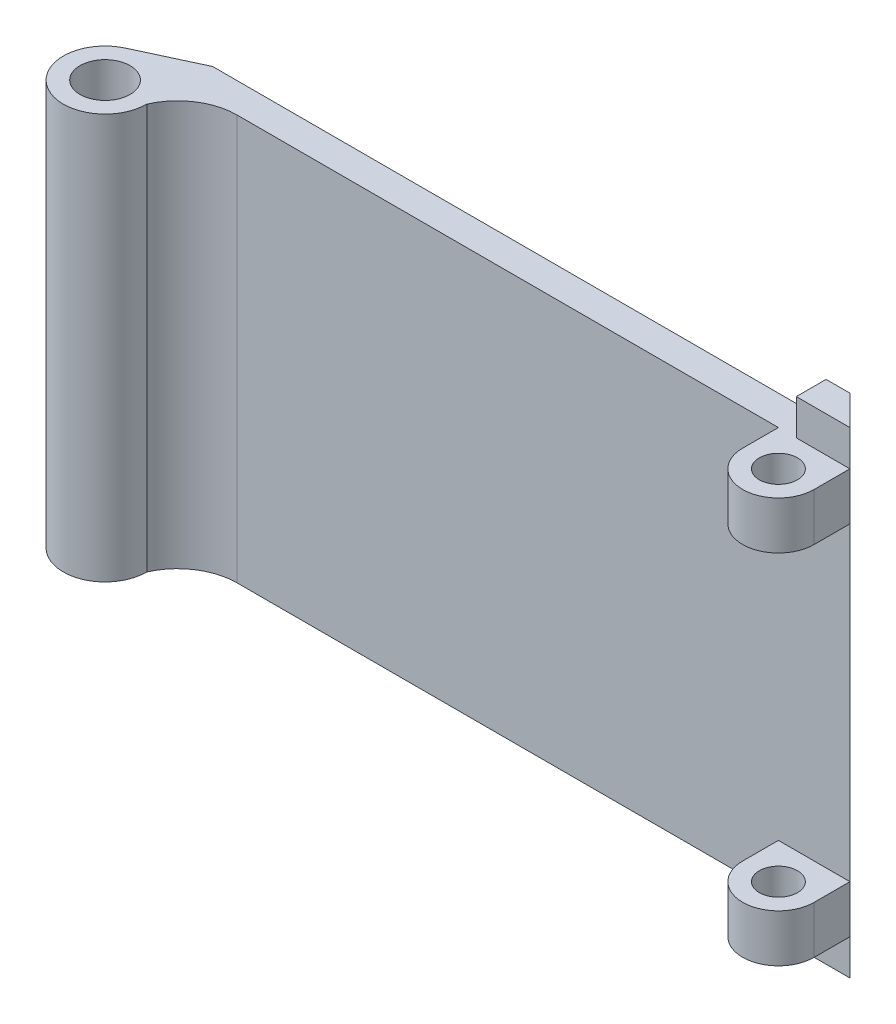
from build123d import *

# Parameters (mm, degrees)
SKETCH_1_W                  = 60
SKETCH_1_H                  = 34
EXTRUDE_1_DEPTH             = 2.5
SKETCH_3_R                  = 3
SKETCH_3_R_2                = 1.6
EXTRUDE_2_DEPTH             = 4
PATTERN_LINEAR_1_COUNT      = 2
PATTERN_LINEAR_1_PITCH      = 56.5
PATTERN_LINEAR_1_COUNT_DIR2 = 2
PATTERN_LINEAR_1_PITCH_DIR2 = 30
SKETCH_5_W                  = 2.5
SKETCH_5_H                  = 34
EXTRUDE_3_DEPTH             = 4
SKETCH_6_W                  = 2.5
SKETCH_6_H                  = 34
EXTRUDE_4_DEPTH             = 4
CUT_EXTRUDE_1_DEPTH         = 73.9674585
EXTRUDE_13_REACH            = 73.192
SKETCH_8_R                  = 1.6
CUT_EXTRUDE_2_DEPTH         = 73.9674585
EXTRUDE_START               = -34
EXTRUDE_14_DEPTH            = 34
SKETCH_10_W                 = 1.5
SKETCH_10_H                 = 2.5
CUT_EXTRUDE_3_DEPTH         = 34
CUT_EXTRUDE_4_DEPTH         = 72.655425475
CUT_EXTRUDE_4_DEPTH_BACK    = 72.655425475
EXTRUDE_16_DEPTH            = 3
EXTRUDE_17_DEPTH            = 3
SKETCH_15_R                 = 2.1
CUT_EXTRUDE_6_DEPTH         = 74.126602547
EXTRUDE_18_DEPTH            = 34
FILLET_1_R                  = 5


# Read off the part's stored shape, not the designer's step: 凸台-拉伸18
with BuildPart() as part:
    # 草图1 → 凸台-拉伸1 (new body)
    with BuildSketch(Plane.XY):
        with Locations((30, 17)):
            Rectangle(SKETCH_1_W, SKETCH_1_H)
    extrude(amount=EXTRUDE_1_DEPTH)

    # 草图3 → 凸台-拉伸2 (add)
    # profile 1 of 3: a face of its own
    with BuildSketch(Plane.XZ):
        with BuildLine():
            Line((6, 2.5), (6, 5.5))
            ThreePointArc((6, 5.5), (5.121320344, 3.378679656), (3, 2.5))
            Line((3, 2.5), (6, 2.5))
        make_face()
    # profile 2 of 3: a face of its own
    with BuildSketch(Plane.XZ):
        with BuildLine():
            ThreePointArc((3, 2.5), (0.878679656, 3.378679656), (0, 5.5))
            Line((0, 5.5), (0, 2.5))
            Line((0, 2.5), (3, 2.5))
        make_face()
    # profile 3 of 3: a face of its own
    with BuildSketch(Plane.XZ):
        with Locations((3, 5.5)):
            Circle(SKETCH_3_R)
        with Locations((3, 5.5)):
            Circle(SKETCH_3_R_2, mode=Mode.SUBTRACT)
    extrude_2 = extrude(amount=-EXTRUDE_2_DEPTH)

    # 阵列(线性)1: Extrude 2 2 × 2
    with Locations(*[(i * PATTERN_LINEAR_1_PITCH, j * PATTERN_LINEAR_1_PITCH_DIR2, 0) for i in range(PATTERN_LINEAR_1_COUNT) for j in range(PATTERN_LINEAR_1_COUNT_DIR2) if (i, j) != (0, 0)]):
        add(extrude_2)

    # 草图5 → 凸台-拉伸3 (add)
    with BuildSketch(Plane.ZY):
        with Locations((1.25, 17)):
            Rectangle(SKETCH_5_W, SKETCH_5_H)
    extrude(amount=EXTRUDE_3_DEPTH)

    # 草图6 → 凸台-拉伸4 (add)
    with BuildSketch(Plane(origin=(60, 0, 0), x_dir=(0, 0, -1), z_dir=(1, 0, 0))):
        with Locations((-1.25, 17)):
            Rectangle(SKETCH_6_W, SKETCH_6_H)
    extrude(amount=EXTRUDE_4_DEPTH)

    # 草图7 → 切除-拉伸1 (cut, through all)
    with BuildSketch(Plane(origin=(0, 34, 0), x_dir=(1, 0, 0), z_dir=(0, 1, 0))):
        with BuildLine():
            ThreePointArc((0, -5.5), (0.878679656, -3.378679656), (3, -2.5))
            Line((3, -2.5), (3, 0))
            Line((3, 0), (-4, 0))
            Line((-4, 0), (-4, -2.5))
            Line((-4, -2.5), (0, -2.5))
            Line((0, -2.5), (0, -5.5))
        make_face()
    extrude(amount=-CUT_EXTRUDE_1_DEPTH, mode=Mode.SUBTRACT)

    # 草图8 → 凸台-拉伸13 (add, up to next)
    with BuildSketch(Plane(origin=(0, 4, 0), x_dir=(1, 0, 0), z_dir=(0, 1, 0)), mode=Mode.PRIVATE) as extrude_13_sk1:
        with BuildLine():
            ThreePointArc((3, -2.5), (0.878679656, -7.621320344), (6, -5.5))
            ThreePointArc((6, -5.5), (5.121320344, -3.378679656), (3, -2.5))
        make_face()
        with Locations((3, -5.5)):
            Circle(SKETCH_8_R, mode=Mode.SUBTRACT)
    extrude_13_tool1 = extrude(extrude_13_sk1.sketch, amount=EXTRUDE_13_REACH, mode=Mode.PRIVATE) - part.part
    # 草图8 → 凸台-拉伸13 (add, up to next)
    with BuildSketch(Plane(origin=(0, 4, 0), x_dir=(1, 0, 0), z_dir=(0, 1, 0)), mode=Mode.PRIVATE) as extrude_13_sk2:
        with BuildLine():
            ThreePointArc((3, -2.5), (5.121320344, -3.378679656), (6, -5.5))
            Line((6, -5.5), (6, -2.5))
            Line((6, -2.5), (3, -2.5))
        make_face()
    extrude_13_tool2 = extrude(extrude_13_sk2.sketch, amount=EXTRUDE_13_REACH, mode=Mode.PRIVATE) - part.part
    add(extrude_13_tool1.solids().sort_by_distance((5.06132, 4, 3.43868))[0])
    add(extrude_13_tool2.solids().sort_by_distance((5.329896, 4, 3.170104))[0])

    # 草图9 → 切除-拉伸2 (cut, through all)
    with BuildSketch(Plane(origin=(0, 34, 0), x_dir=(1, 0, 0), z_dir=(0, 1, 0))):
        Polygon((3, 0), (3, -2.035898385), (6.526279442, 0), align=None)
    extrude(amount=-CUT_EXTRUDE_2_DEPTH, mode=Mode.SUBTRACT)

    # 草图9<3> → 凸台-拉伸14 (add)
    with BuildSketch(Plane(origin=(0, 34, 0), x_dir=(1, 0, 0), z_dir=(0, 1, 0)).offset(EXTRUDE_START)):
        Polygon((6, -2.5), (6, -3.190598923), (7.196152423, -2.5), align=None)
        with BuildLine():
            Line((3, -2.035898385), (1.5, -2.901923789))
            ThreePointArc((1.5, -2.901923789), (2.223542865, -2.602222521), (3, -2.5))
            Line((3, -2.5), (3, -2.035898385))
        make_face()
    extrude(amount=EXTRUDE_14_DEPTH)

    # 草图10 → 切除-拉伸3 (cut)
    with BuildSketch(Plane(origin=(0, 34, 0), x_dir=(1, 0, 0), z_dir=(0, 1, 0))):
        with Locations((63.25, -1.25)):
            Rectangle(SKETCH_10_W, SKETCH_10_H)
    extrude(amount=-CUT_EXTRUDE_3_DEPTH, mode=Mode.SUBTRACT)

    # 草图11 → 切除-拉伸4 (cut, two sides: drawn at the far end of the back side and taken through both)
    with BuildSketch(Plane(origin=(0, 34, 0), x_dir=(1, 0, 0), z_dir=(0, 1, 0)).offset(-CUT_EXTRUDE_4_DEPTH_BACK)):
        Polygon((60, 0), (62.5, -2.5), (62.5, 0), align=None)
    extrude(amount=CUT_EXTRUDE_4_DEPTH + CUT_EXTRUDE_4_DEPTH_BACK, mode=Mode.SUBTRACT)

    # 草图13 → 凸台-拉伸16 (add)
    with BuildSketch(Plane(origin=(0, 34, 0), x_dir=(1, 0, 0), z_dir=(0, 1, 0))):
        Polygon((62.5, -2.5), (58, -2.5), (58, 0), (60, 0), align=None)
    extrude(amount=EXTRUDE_16_DEPTH)

    # 草图14 → 凸台-拉伸17 (add)
    with BuildSketch(Plane.XZ):
        Polygon((62.5, 2.5), (60, 0), (58, 0), (58, 2.5), align=None)
    extrude(amount=EXTRUDE_17_DEPTH)

    # 草图15 → 切除-拉伸6 (cut, through all)
    with BuildSketch(Plane.XZ):
        with Locations((3, 5.5)):
            Circle(SKETCH_15_R)
    extrude(amount=-CUT_EXTRUDE_6_DEPTH, mode=Mode.SUBTRACT)

    # 凸台-拉伸18 outline → 凸台-拉伸18 (add)
    with BuildSketch(Plane(origin=(0, 0, 0), x_dir=(-1, 0, 0), z_dir=(0, -1, 0)).offset(EXTRUDE_START)):
        with BuildLine():
            Line((-7.196152423, -2.5), (-6.5, -5.5))
            ThreePointArc((-6.5, -5.5), (-1.117959969, -8.450919402), (-1.524042675, -2.32642946))
            Line((-1.524042675, -2.32642946), (-6.526279442, 0))
            Line((-6.526279442, 0), (-1.5, -2.901923789))
            ThreePointArc((-1.5, -2.901923789), (-1.5, -8.098076211), (-6, -5.5))
            Line((-6, -5.5), (-6, -3.190598923))
            Line((-6, -3.190598923), (-7.196152423, -2.5))
        make_face()
    extrude(amount=EXTRUDE_18_DEPTH)

    # 圆角1
    # the kernel refuses this fillet: 5 mm, written as the material it adds along each edge
    with BuildSketch(Plane(origin=(7.196152423, 0, 2.5), x_dir=(1, 0, 0), z_dir=(0, 1, 0))) as fillet_1_piece_1:
        with BuildLine():
            CenterArc((3.886423272, -5), FILLET_1_R, 90, 66.421821522)
            Line((-0.696152423, -3), (-0.787803937, -2.96))
            ThreePointArc((-0.787803937, -2.96), (-0.445487906, -1.477395538), (-0.097411695, 0.022604462))
            Line((-0.097411695, 0.022604462), (0, 0.1))
            Line((0, 0.1), (3.886423272, 0.1))
            Line((3.886423272, 0.1), (3.886423272, 0))
        make_face()
    extrude(amount=34)


solid = part.part
